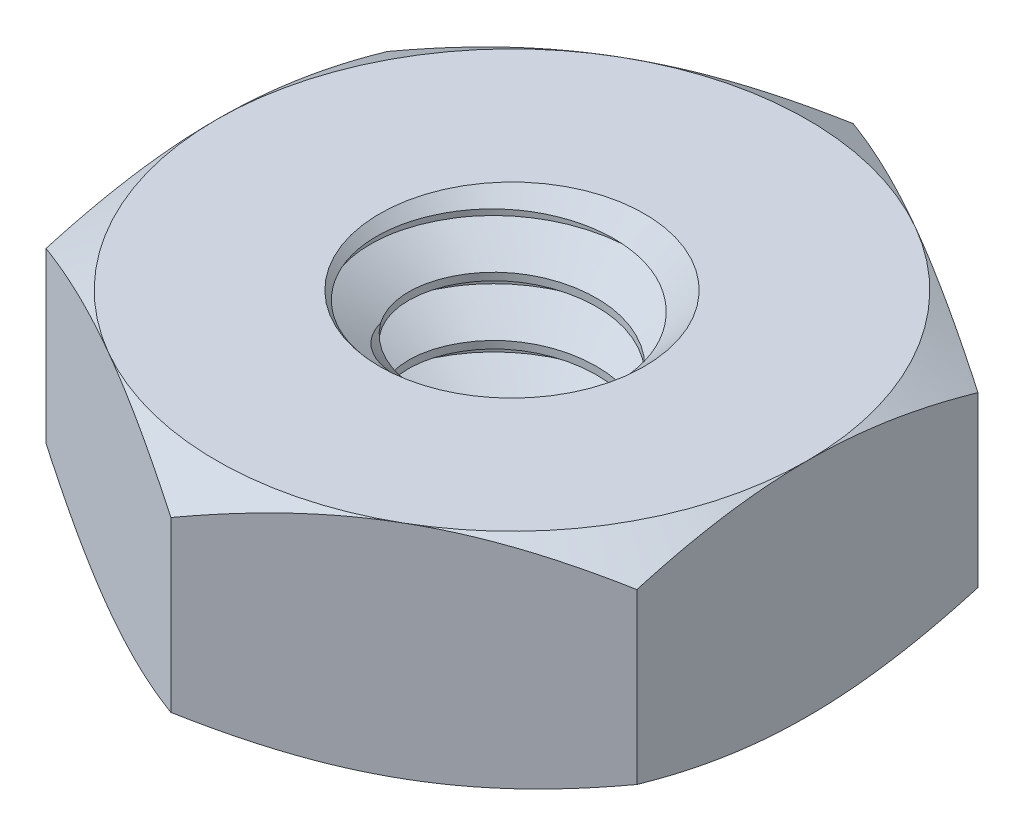
from build123d import *

# Parameters (mm, degrees)
SKETCH1_R               = 1.4224
BOSS_EXTRUDE1_DEPTH     = 1.190625
SKETCH5_OUTSIDE_W       = 32.528
SKETCH5_OUTSIDE_H       = 33.51
SKETCH5_OUTSIDE_R       = 3.175
CUT_EXTRUDE2_DEPTH      = 6.402944558
CUT_EXTRUDE2_DRAFT      = -60
MIRROR1_COPY_1_SKETCH_W = 32.528
MIRROR1_COPY_1_SKETCH_H = 33.51
MIRROR1_COPY_1_SKETCH_R = 3.175
MIRROR1_COPY_1_DEPTH    = 6.402944558
MIRROR1_COPY_1_DRAFT    = -60
SKETCH8_R               = 1.4224
BOSS_EXTRUDE2_DEPTH     = 2.38125
BOSS_EXTRUDE3_START     = -2.38125
SKETCH9_R               = 1.4224
BOSS_EXTRUDE3_DEPTH     = 2.38125
CUT_SWEEP1_PITCH        = 0.635


with BuildPart() as part:
    # Sketch1 → Boss-Extrude1 (new, symmetric)
    with BuildSketch(Plane(origin=(0, 0, 0), x_dir=(1, 0, 0), z_dir=(0, 1, 0))):
        Polygon((-3.175, 1.833087105), (-3.175, -1.833087105), (0, -3.666174209), (3.175, -1.833087105), (3.175, 1.833087105), (0, 3.666174209), align=None)
        with Locations(Location((0, 0, 0), (0, 0, 90))):
            Circle(SKETCH1_R, mode=Mode.SUBTRACT)
    extrude(amount=BOSS_EXTRUDE1_DEPTH, both=True)


with BuildPart() as cut_extrude2_tool:
    # Sketch5 outside → Cut-Extrude2 (with draft: the straight prism first)
    with BuildSketch(Plane(origin=(0, 1.190625, 0), x_dir=(1, 0, 0), z_dir=(0, 1, 0))):
        Rectangle(SKETCH5_OUTSIDE_W, SKETCH5_OUTSIDE_H)
        Circle(SKETCH5_OUTSIDE_R, mode=Mode.SUBTRACT)
    extrude(amount=-CUT_EXTRUDE2_DEPTH)
    # Cut-Extrude2: the draft: its side faces are tilted about the plane it starts from
    cut_extrude2_sides = [cut_extrude2_tool.faces().sort_by_distance(p)[0] for p in [
        (0, -2.010847279, 16.755),
        (16.264, -2.010847279, 0),
        (0, -2.010847279, -16.755),
        (-16.264, -2.010847279, 0),
        (-3.175, -2.010847279, 0),
    ]]
    draft(cut_extrude2_sides, Plane(origin=(0, 1.190625, 0), x_dir=(1, 0, 0), z_dir=(0, 1, 0)), CUT_EXTRUDE2_DRAFT)


with BuildPart() as part_1:
    add(part.part)

    # Cut-Extrude2: cut by cut_extrude2_tool
    add(cut_extrude2_tool.part, mode=Mode.SUBTRACT)


with BuildPart() as mirror1_copy_1_tool:
    # Mirror1 copy 1 sketch → Mirror1 copy 1 (with draft: the straight prism first)
    with BuildSketch(Plane.XZ.offset(1.190625)):
        Rectangle(MIRROR1_COPY_1_SKETCH_W, MIRROR1_COPY_1_SKETCH_H)
        Circle(MIRROR1_COPY_1_SKETCH_R, mode=Mode.SUBTRACT)
    extrude(amount=-MIRROR1_COPY_1_DEPTH)
    # Mirror1 copy 1: the draft: its side faces are tilted about the plane it starts from
    mirror1_copy_1_sides = [mirror1_copy_1_tool.faces().sort_by_distance(p)[0] for p in [
        (0, 2.010847279, 16.755),
        (16.264, 2.010847279, 0),
        (0, 2.010847279, -16.755),
        (-16.264, 2.010847279, 0),
        (-3.175, 2.010847279, 0),
    ]]
    draft(mirror1_copy_1_sides, Plane.XZ.offset(1.190625), MIRROR1_COPY_1_DRAFT)


with BuildPart() as part_2:
    add(part_1.part)

    # Mirror1 copy 1: cut by mirror1_copy_1_tool
    add(mirror1_copy_1_tool.part, mode=Mode.SUBTRACT)

    # Sketch9 → Boss-Extrude3 (add)
    with BuildSketch(Plane(origin=(0, 1.190625, 0), x_dir=(1, 0, 0), z_dir=(0, 1, 0)).offset(BOSS_EXTRUDE3_START)):
        with Locations(Location((0, 0, 0), (0, 0, 270))):
            Circle(SKETCH9_R)
    extrude(amount=BOSS_EXTRUDE3_DEPTH)


with BuildPart() as body_2:
    # Sketch8 → Boss-Extrude2 (new body)
    with BuildSketch(Plane(origin=(0, 1.190625, 0), x_dir=(1, 0, 0), z_dir=(0, 1, 0))):
        with Locations(Location((0, 0, 0), (0, 0, 270))):
            Circle(SKETCH8_R)
    extrude(amount=-BOSS_EXTRUDE2_DEPTH)

    # Cut-Sweep1: the profile of Sketch11 profile screwed along a right-hand helix of 4.75 turns, 6 arcs to a turn; built about Z, then put on its axis
    cut_sweep1_z = Axis((0, 0, 0), (0, 0, 1))
    cut_sweep1_corners = [(1.4227, 0, 0.000173205), (1.4227, 0, -0.555798205), (1.009955401, 0, -0.3175), (1.009955401, 0, -0.238125)]
    with BuildLine(mode=Mode.PRIVATE) as cut_sweep1_profile:
        Line(cut_sweep1_corners[0], cut_sweep1_corners[1])
        Line(cut_sweep1_corners[1], cut_sweep1_corners[2])
        Line(cut_sweep1_corners[2], cut_sweep1_corners[3])
        Line(cut_sweep1_corners[3], cut_sweep1_corners[0])
    cut_sweep1_cap = Face(cut_sweep1_profile.wire())
    cut_sweep1_turn_angles = [0, 30, 60, 90, 120, 150, 180, 210, 240, 270, 300, 330, 360]
    cut_sweep1_turn_weights = [1, 0.8660254037844387, 1, 0.8660254037844387, 1, 0.8660254037844387, 1, 0.8660254037844387, 1, 0.8660254037844387, 1, 0.8660254037844387, 1]
    cut_sweep1_turn_rails = [Edge.make_bspline([Vector(p[0], p[1], 0).rotate(cut_sweep1_z, cut_sweep1_turn_angles[k]) / cut_sweep1_turn_weights[k] + Vector(0, 0, p[2] + CUT_SWEEP1_PITCH * cut_sweep1_turn_angles[k] / 360) for k in range(13)], [0, 0, 0, 1, 1, 2, 2, 3, 3, 4, 4, 5, 5, 6, 6, 6], 2, cut_sweep1_turn_weights) for p in cut_sweep1_corners]
    cut_sweep1_turn_sides = [Face.make_surface_from_curves(cut_sweep1_turn_rails[p[0]], cut_sweep1_turn_rails[p[1]]) for p in [(0, 1), (1, 2), (2, 3), (3, 0)]]
    cut_sweep1_last_angles = [1440, 1470, 1500, 1530, 1560, 1590, 1620, 1650, 1680, 1695, 1710]
    cut_sweep1_last_weights = [1, 0.8660254037844387, 1, 0.8660254037844387, 1, 0.8660254037844387, 1, 0.8660254037844387, 1, 0.9659258262890632, 1]
    cut_sweep1_last_rails = [Edge.make_bspline([Vector(p[0], p[1], 0).rotate(cut_sweep1_z, cut_sweep1_last_angles[k]) / cut_sweep1_last_weights[k] + Vector(0, 0, p[2] + CUT_SWEEP1_PITCH * cut_sweep1_last_angles[k] / 360) for k in range(11)], [0, 0, 0, 1, 1, 2, 2, 3, 3, 4, 4, 5, 5, 5], 2, cut_sweep1_last_weights) for p in cut_sweep1_corners]
    cut_sweep1_last_sides = [Face.make_surface_from_curves(cut_sweep1_last_rails[p[0]], cut_sweep1_last_rails[p[1]]) for p in [(0, 1), (1, 2), (2, 3), (3, 0)]]
    cut_sweep1 = Plane(origin=(0, 1.190625, 0), x_dir=(0, 0, 1), z_dir=(0, -1, 0)) * Solid(Shell([*[p.moved(Location((0, 0, CUT_SWEEP1_PITCH * i))) for i in range(4) for p in cut_sweep1_turn_sides], *cut_sweep1_last_sides, cut_sweep1_cap, cut_sweep1_cap.rotate(cut_sweep1_z, 1710).moved(Location((0, 0, CUT_SWEEP1_PITCH * 1710 / 360)))]))
    add(cut_sweep1, mode=Mode.SUBTRACT)


with BuildPart() as part_3:
    add(part_2.part)

    # Combine1: cut body 2
    add(body_2.part, mode=Mode.SUBTRACT)

    # Cut-Extrude3 cone 1 section (through the dimple's axis) → Cut-Extrude3 (revolve, cut)
    with BuildSketch(Plane(origin=(0, 1.190625, 0), x_dir=(0, 0, 1), z_dir=(1, 0, 0))):
        Polygon((0, 0), (1.4224, 0), (0, 1.4224), align=None)
    revolve(axis=Axis((0, 1.190625, 0), (0, -1, 0)), mode=Mode.SUBTRACT)

    # Cut-Extrude4 cone 1 section (through the dimple's axis) → Cut-Extrude4 (revolve, cut)
    with BuildSketch(Plane(origin=(0, -1.190625, 0), x_dir=(0, 0, -1), z_dir=(1, 0, 0))):
        Polygon((0, 0), (1.4224, 0), (0, 1.4224), align=None)
    revolve(axis=Axis((0, -1.190625, 0), (0, 1, 0)), mode=Mode.SUBTRACT)


solid = part_3.part
